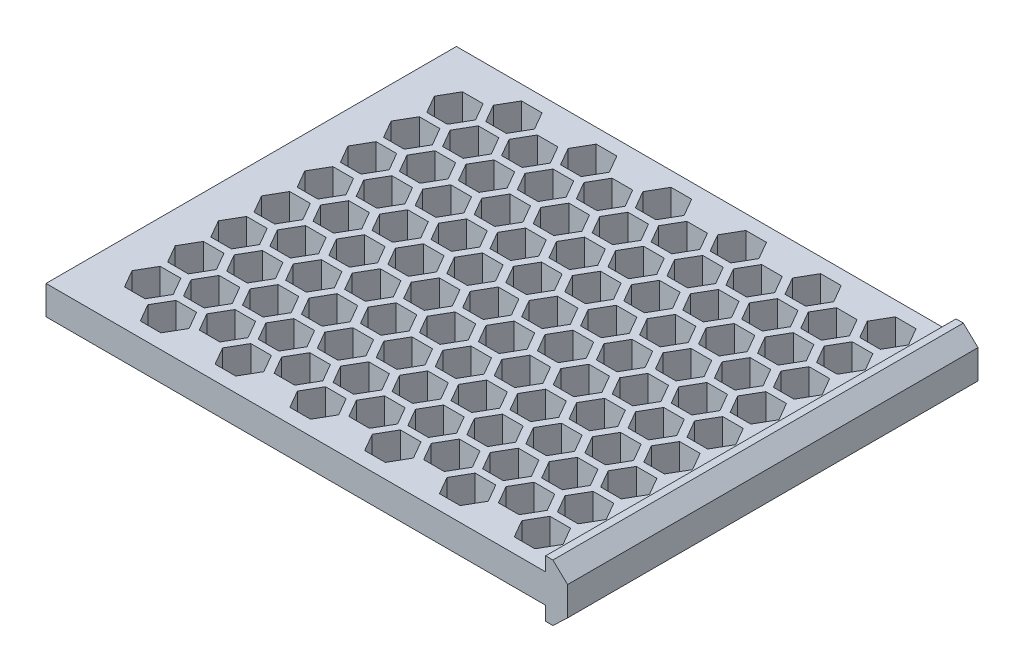
from build123d import *

# Parameters (mm, degrees)
BOSS_EXTRUDE1_DEPTH = 115
CUT_EXTRUDE3_DEPTH  = 182.573676506


with BuildPart() as part:
    # Sketch1 → Boss-Extrude1 (new body)
    with BuildSketch(Plane.XY):
        Polygon((-140, -4.05), (0, -4.05), (0, -7.95), (2.04, -7.95), (6.152414984, -4.048), (6.152414984, 4.048), (2.04, 7.95), (0, 7.95), (0, 4.05), (-140, 4.05), align=None)
    extrude(amount=BOSS_EXTRUDE1_DEPTH)

    # Sketch2 → Cut-Extrude3 (cut, through all)
    with BuildSketch(Plane(origin=(0, 4.05, 0), x_dir=(1, 0, 0), z_dir=(0, 1, 0))):
        Polygon((-7.113248654, -14.1), (-4.226497308, -9.1), (-7.113248654, -4.1), (-12.886751346, -4.1), (-15.773502692, -9.1), (-12.886751346, -14.1), align=None)
        Polygon((-7.113248654, -26.2), (-4.226497308, -21.2), (-7.113248654, -16.2), (-12.886751346, -16.2), (-15.773502692, -21.2), (-12.886751346, -26.2), align=None)
        Polygon((-7.113248654, -38.3), (-4.226497308, -33.3), (-7.113248654, -28.3), (-12.886751346, -28.3), (-15.773502692, -33.3), (-12.886751346, -38.3), align=None)
        Polygon((-7.113248654, -50.4), (-4.226497308, -45.4), (-7.113248654, -40.4), (-12.886751346, -40.4), (-15.773502692, -45.4), (-12.886751346, -50.4), align=None)
        Polygon((-7.113248654, -62.5), (-4.226497308, -57.5), (-7.113248654, -52.5), (-12.886751346, -52.5), (-15.773502692, -57.5), (-12.886751346, -62.5), align=None)
        Polygon((-7.113248654, -74.6), (-4.226497308, -69.6), (-7.113248654, -64.6), (-12.886751346, -64.6), (-15.773502692, -69.6), (-12.886751346, -74.6), align=None)
        Polygon((-7.113248654, -86.7), (-4.226497308, -81.7), (-7.113248654, -76.7), (-12.886751346, -76.7), (-15.773502692, -81.7), (-12.886751346, -86.7), align=None)
        Polygon((-7.113248654, -98.8), (-4.226497308, -93.8), (-7.113248654, -88.8), (-12.886751346, -88.8), (-15.773502692, -93.8), (-12.886751346, -98.8), align=None)
        Polygon((-7.113248654, -110.9), (-4.226497308, -105.9), (-7.113248654, -100.9), (-12.886751346, -100.9), (-15.773502692, -105.9), (-12.886751346, -110.9), align=None)
        Polygon((-17.59215604, -20.15), (-14.705404694, -15.15), (-17.59215604, -10.15), (-23.365658732, -10.15), (-26.252410078, -15.15), (-23.365658732, -20.15), align=None)
        Polygon((-17.59215604, -32.25), (-14.705404694, -27.25), (-17.59215604, -22.25), (-23.365658732, -22.25), (-26.252410078, -27.25), (-23.365658732, -32.25), align=None)
        Polygon((-17.59215604, -44.35), (-14.705404694, -39.35), (-17.59215604, -34.35), (-23.365658732, -34.35), (-26.252410078, -39.35), (-23.365658732, -44.35), align=None)
        Polygon((-17.59215604, -56.45), (-14.705404694, -51.45), (-17.59215604, -46.45), (-23.365658732, -46.45), (-26.252410078, -51.45), (-23.365658732, -56.45), align=None)
        Polygon((-17.59215604, -68.55), (-14.705404694, -63.55), (-17.59215604, -58.55), (-23.365658732, -58.55), (-26.252410078, -63.55), (-23.365658732, -68.55), align=None)
        Polygon((-17.59215604, -80.65), (-14.705404694, -75.65), (-17.59215604, -70.65), (-23.365658732, -70.65), (-26.252410078, -75.65), (-23.365658732, -80.65), align=None)
        Polygon((-17.59215604, -92.75), (-14.705404694, -87.75), (-17.59215604, -82.75), (-23.365658732, -82.75), (-26.252410078, -87.75), (-23.365658732, -92.75), align=None)
        Polygon((-17.59215604, -104.85), (-14.705404694, -99.85), (-17.59215604, -94.85), (-23.365658732, -94.85), (-26.252410078, -99.85), (-23.365658732, -104.85), align=None)
        Polygon((-28.071063426, -14.1), (-25.18431208, -9.1), (-28.071063426, -4.1), (-33.844566118, -4.1), (-36.731317463, -9.1), (-33.844566118, -14.1), align=None)
        Polygon((-28.071063426, -26.2), (-25.18431208, -21.2), (-28.071063426, -16.2), (-33.844566118, -16.2), (-36.731317463, -21.2), (-33.844566118, -26.2), align=None)
        Polygon((-28.071063426, -38.3), (-25.18431208, -33.3), (-28.071063426, -28.3), (-33.844566118, -28.3), (-36.731317463, -33.3), (-33.844566118, -38.3), align=None)
        Polygon((-28.071063426, -50.4), (-25.18431208, -45.4), (-28.071063426, -40.4), (-33.844566118, -40.4), (-36.731317463, -45.4), (-33.844566118, -50.4), align=None)
        Polygon((-28.071063426, -62.5), (-25.18431208, -57.5), (-28.071063426, -52.5), (-33.844566118, -52.5), (-36.731317463, -57.5), (-33.844566118, -62.5), align=None)
        Polygon((-28.071063426, -74.6), (-25.18431208, -69.6), (-28.071063426, -64.6), (-33.844566118, -64.6), (-36.731317463, -69.6), (-33.844566118, -74.6), align=None)
        Polygon((-28.071063426, -86.7), (-25.18431208, -81.7), (-28.071063426, -76.7), (-33.844566118, -76.7), (-36.731317463, -81.7), (-33.844566118, -86.7), align=None)
        Polygon((-28.071063426, -98.8), (-25.18431208, -93.8), (-28.071063426, -88.8), (-33.844566118, -88.8), (-36.731317463, -93.8), (-33.844566118, -98.8), align=None)
        Polygon((-28.071063426, -110.9), (-25.18431208, -105.9), (-28.071063426, -100.9), (-33.844566118, -100.9), (-36.731317463, -105.9), (-33.844566118, -110.9), align=None)
        Polygon((-38.549970811, -20.15), (-35.663219465, -15.15), (-38.549970811, -10.15), (-44.323473503, -10.15), (-47.210224849, -15.15), (-44.323473503, -20.15), align=None)
        Polygon((-38.549970811, -32.25), (-35.663219465, -27.25), (-38.549970811, -22.25), (-44.323473503, -22.25), (-47.210224849, -27.25), (-44.323473503, -32.25), align=None)
        Polygon((-38.549970811, -44.35), (-35.663219465, -39.35), (-38.549970811, -34.35), (-44.323473503, -34.35), (-47.210224849, -39.35), (-44.323473503, -44.35), align=None)
        Polygon((-38.549970811, -56.45), (-35.663219465, -51.45), (-38.549970811, -46.45), (-44.323473503, -46.45), (-47.210224849, -51.45), (-44.323473503, -56.45), align=None)
        Polygon((-38.549970811, -68.55), (-35.663219465, -63.55), (-38.549970811, -58.55), (-44.323473503, -58.55), (-47.210224849, -63.55), (-44.323473503, -68.55), align=None)
        Polygon((-38.549970811, -80.65), (-35.663219465, -75.65), (-38.549970811, -70.65), (-44.323473503, -70.65), (-47.210224849, -75.65), (-44.323473503, -80.65), align=None)
        Polygon((-38.549970811, -92.75), (-35.663219465, -87.75), (-38.549970811, -82.75), (-44.323473503, -82.75), (-47.210224849, -87.75), (-44.323473503, -92.75), align=None)
        Polygon((-38.549970811, -104.85), (-35.663219465, -99.85), (-38.549970811, -94.85), (-44.323473503, -94.85), (-47.210224849, -99.85), (-44.323473503, -104.85), align=None)
        Polygon((-49.028878197, -14.1), (-46.142126851, -9.1), (-49.028878197, -4.1), (-54.802380889, -4.1), (-57.689132235, -9.1), (-54.802380889, -14.1), align=None)
        Polygon((-49.028878197, -26.2), (-46.142126851, -21.2), (-49.028878197, -16.2), (-54.802380889, -16.2), (-57.689132235, -21.2), (-54.802380889, -26.2), align=None)
        Polygon((-49.028878197, -38.3), (-46.142126851, -33.3), (-49.028878197, -28.3), (-54.802380889, -28.3), (-57.689132235, -33.3), (-54.802380889, -38.3), align=None)
        Polygon((-49.028878197, -50.4), (-46.142126851, -45.4), (-49.028878197, -40.4), (-54.802380889, -40.4), (-57.689132235, -45.4), (-54.802380889, -50.4), align=None)
        Polygon((-49.028878197, -62.5), (-46.142126851, -57.5), (-49.028878197, -52.5), (-54.802380889, -52.5), (-57.689132235, -57.5), (-54.802380889, -62.5), align=None)
        Polygon((-49.028878197, -74.6), (-46.142126851, -69.6), (-49.028878197, -64.6), (-54.802380889, -64.6), (-57.689132235, -69.6), (-54.802380889, -74.6), align=None)
        Polygon((-49.028878197, -86.7), (-46.142126851, -81.7), (-49.028878197, -76.7), (-54.802380889, -76.7), (-57.689132235, -81.7), (-54.802380889, -86.7), align=None)
        Polygon((-49.028878197, -98.8), (-46.142126851, -93.8), (-49.028878197, -88.8), (-54.802380889, -88.8), (-57.689132235, -93.8), (-54.802380889, -98.8), align=None)
        Polygon((-49.028878197, -110.9), (-46.142126851, -105.9), (-49.028878197, -100.9), (-54.802380889, -100.9), (-57.689132235, -105.9), (-54.802380889, -110.9), align=None)
        Polygon((-59.507785583, -20.15), (-56.621034237, -15.15), (-59.507785583, -10.15), (-65.281288275, -10.15), (-68.168039621, -15.15), (-65.281288275, -20.15), align=None)
        Polygon((-59.507785583, -32.25), (-56.621034237, -27.25), (-59.507785583, -22.25), (-65.281288275, -22.25), (-68.168039621, -27.25), (-65.281288275, -32.25), align=None)
        Polygon((-59.507785583, -44.35), (-56.621034237, -39.35), (-59.507785583, -34.35), (-65.281288275, -34.35), (-68.168039621, -39.35), (-65.281288275, -44.35), align=None)
        Polygon((-59.507785583, -56.45), (-56.621034237, -51.45), (-59.507785583, -46.45), (-65.281288275, -46.45), (-68.168039621, -51.45), (-65.281288275, -56.45), align=None)
        Polygon((-59.507785583, -68.55), (-56.621034237, -63.55), (-59.507785583, -58.55), (-65.281288275, -58.55), (-68.168039621, -63.55), (-65.281288275, -68.55), align=None)
        Polygon((-59.507785583, -80.65), (-56.621034237, -75.65), (-59.507785583, -70.65), (-65.281288275, -70.65), (-68.168039621, -75.65), (-65.281288275, -80.65), align=None)
        Polygon((-59.507785583, -92.75), (-56.621034237, -87.75), (-59.507785583, -82.75), (-65.281288275, -82.75), (-68.168039621, -87.75), (-65.281288275, -92.75), align=None)
        Polygon((-59.507785583, -104.85), (-56.621034237, -99.85), (-59.507785583, -94.85), (-65.281288275, -94.85), (-68.168039621, -99.85), (-65.281288275, -104.85), align=None)
        Polygon((-69.986692969, -14.1), (-67.099941623, -9.1), (-69.986692969, -4.1), (-75.760195661, -4.1), (-78.646947007, -9.1), (-75.760195661, -14.1), align=None)
        Polygon((-69.986692969, -26.2), (-67.099941623, -21.2), (-69.986692969, -16.2), (-75.760195661, -16.2), (-78.646947007, -21.2), (-75.760195661, -26.2), align=None)
        Polygon((-69.986692969, -38.3), (-67.099941623, -33.3), (-69.986692969, -28.3), (-75.760195661, -28.3), (-78.646947007, -33.3), (-75.760195661, -38.3), align=None)
        Polygon((-69.986692969, -50.4), (-67.099941623, -45.4), (-69.986692969, -40.4), (-75.760195661, -40.4), (-78.646947007, -45.4), (-75.760195661, -50.4), align=None)
        Polygon((-69.986692969, -62.5), (-67.099941623, -57.5), (-69.986692969, -52.5), (-75.760195661, -52.5), (-78.646947007, -57.5), (-75.760195661, -62.5), align=None)
        Polygon((-69.986692969, -74.6), (-67.099941623, -69.6), (-69.986692969, -64.6), (-75.760195661, -64.6), (-78.646947007, -69.6), (-75.760195661, -74.6), align=None)
        Polygon((-69.986692969, -86.7), (-67.099941623, -81.7), (-69.986692969, -76.7), (-75.760195661, -76.7), (-78.646947007, -81.7), (-75.760195661, -86.7), align=None)
        Polygon((-69.986692969, -98.8), (-67.099941623, -93.8), (-69.986692969, -88.8), (-75.760195661, -88.8), (-78.646947007, -93.8), (-75.760195661, -98.8), align=None)
        Polygon((-69.986692969, -110.9), (-67.099941623, -105.9), (-69.986692969, -100.9), (-75.760195661, -100.9), (-78.646947007, -105.9), (-75.760195661, -110.9), align=None)
        Polygon((-80.465600355, -20.15), (-77.578849009, -15.15), (-80.465600355, -10.15), (-86.239103046, -10.15), (-89.125854392, -15.15), (-86.239103046, -20.15), align=None)
        Polygon((-80.465600355, -32.25), (-77.578849009, -27.25), (-80.465600355, -22.25), (-86.239103046, -22.25), (-89.125854392, -27.25), (-86.239103046, -32.25), align=None)
        Polygon((-80.465600355, -44.35), (-77.578849009, -39.35), (-80.465600355, -34.35), (-86.239103046, -34.35), (-89.125854392, -39.35), (-86.239103046, -44.35), align=None)
        Polygon((-80.465600355, -56.45), (-77.578849009, -51.45), (-80.465600355, -46.45), (-86.239103046, -46.45), (-89.125854392, -51.45), (-86.239103046, -56.45), align=None)
        Polygon((-80.465600355, -68.55), (-77.578849009, -63.55), (-80.465600355, -58.55), (-86.239103046, -58.55), (-89.125854392, -63.55), (-86.239103046, -68.55), align=None)
        Polygon((-80.465600355, -80.65), (-77.578849009, -75.65), (-80.465600355, -70.65), (-86.239103046, -70.65), (-89.125854392, -75.65), (-86.239103046, -80.65), align=None)
        Polygon((-80.465600355, -92.75), (-77.578849009, -87.75), (-80.465600355, -82.75), (-86.239103046, -82.75), (-89.125854392, -87.75), (-86.239103046, -92.75), align=None)
        Polygon((-80.465600355, -104.85), (-77.578849009, -99.85), (-80.465600355, -94.85), (-86.239103046, -94.85), (-89.125854392, -99.85), (-86.239103046, -104.85), align=None)
        Polygon((-90.94450774, -14.1), (-88.057756394, -9.1), (-90.94450774, -4.1), (-96.718010432, -4.1), (-99.604761778, -9.1), (-96.718010432, -14.1), align=None)
        Polygon((-90.94450774, -26.2), (-88.057756394, -21.2), (-90.94450774, -16.2), (-96.718010432, -16.2), (-99.604761778, -21.2), (-96.718010432, -26.2), align=None)
        Polygon((-90.94450774, -38.3), (-88.057756394, -33.3), (-90.94450774, -28.3), (-96.718010432, -28.3), (-99.604761778, -33.3), (-96.718010432, -38.3), align=None)
        Polygon((-90.94450774, -50.4), (-88.057756394, -45.4), (-90.94450774, -40.4), (-96.718010432, -40.4), (-99.604761778, -45.4), (-96.718010432, -50.4), align=None)
        Polygon((-90.94450774, -62.5), (-88.057756394, -57.5), (-90.94450774, -52.5), (-96.718010432, -52.5), (-99.604761778, -57.5), (-96.718010432, -62.5), align=None)
        Polygon((-90.94450774, -74.6), (-88.057756394, -69.6), (-90.94450774, -64.6), (-96.718010432, -64.6), (-99.604761778, -69.6), (-96.718010432, -74.6), align=None)
        Polygon((-90.94450774, -86.7), (-88.057756394, -81.7), (-90.94450774, -76.7), (-96.718010432, -76.7), (-99.604761778, -81.7), (-96.718010432, -86.7), align=None)
        Polygon((-90.94450774, -98.8), (-88.057756394, -93.8), (-90.94450774, -88.8), (-96.718010432, -88.8), (-99.604761778, -93.8), (-96.718010432, -98.8), align=None)
        Polygon((-90.94450774, -110.9), (-88.057756394, -105.9), (-90.94450774, -100.9), (-96.718010432, -100.9), (-99.604761778, -105.9), (-96.718010432, -110.9), align=None)
        Polygon((-101.423415126, -20.15), (-98.53666378, -15.15), (-101.423415126, -10.15), (-107.196917818, -10.15), (-110.083669164, -15.15), (-107.196917818, -20.15), align=None)
        Polygon((-101.423415126, -32.25), (-98.53666378, -27.25), (-101.423415126, -22.25), (-107.196917818, -22.25), (-110.083669164, -27.25), (-107.196917818, -32.25), align=None)
        Polygon((-101.423415126, -44.35), (-98.53666378, -39.35), (-101.423415126, -34.35), (-107.196917818, -34.35), (-110.083669164, -39.35), (-107.196917818, -44.35), align=None)
        Polygon((-101.423415126, -56.45), (-98.53666378, -51.45), (-101.423415126, -46.45), (-107.196917818, -46.45), (-110.083669164, -51.45), (-107.196917818, -56.45), align=None)
        Polygon((-101.423415126, -68.55), (-98.53666378, -63.55), (-101.423415126, -58.55), (-107.196917818, -58.55), (-110.083669164, -63.55), (-107.196917818, -68.55), align=None)
        Polygon((-101.423415126, -80.65), (-98.53666378, -75.65), (-101.423415126, -70.65), (-107.196917818, -70.65), (-110.083669164, -75.65), (-107.196917818, -80.65), align=None)
        Polygon((-101.423415126, -92.75), (-98.53666378, -87.75), (-101.423415126, -82.75), (-107.196917818, -82.75), (-110.083669164, -87.75), (-107.196917818, -92.75), align=None)
        Polygon((-101.423415126, -104.85), (-98.53666378, -99.85), (-101.423415126, -94.85), (-107.196917818, -94.85), (-110.083669164, -99.85), (-107.196917818, -104.85), align=None)
        Polygon((-111.902322512, -14.1), (-109.015571166, -9.1), (-111.902322512, -4.1), (-117.675825204, -4.1), (-120.56257655, -9.1), (-117.675825204, -14.1), align=None)
        Polygon((-111.902322512, -26.2), (-109.015571166, -21.2), (-111.902322512, -16.2), (-117.675825204, -16.2), (-120.56257655, -21.2), (-117.675825204, -26.2), align=None)
        Polygon((-111.902322512, -38.3), (-109.015571166, -33.3), (-111.902322512, -28.3), (-117.675825204, -28.3), (-120.56257655, -33.3), (-117.675825204, -38.3), align=None)
        Polygon((-111.902322512, -50.4), (-109.015571166, -45.4), (-111.902322512, -40.4), (-117.675825204, -40.4), (-120.56257655, -45.4), (-117.675825204, -50.4), align=None)
        Polygon((-111.902322512, -62.5), (-109.015571166, -57.5), (-111.902322512, -52.5), (-117.675825204, -52.5), (-120.56257655, -57.5), (-117.675825204, -62.5), align=None)
        Polygon((-111.902322512, -74.6), (-109.015571166, -69.6), (-111.902322512, -64.6), (-117.675825204, -64.6), (-120.56257655, -69.6), (-117.675825204, -74.6), align=None)
        Polygon((-111.902322512, -86.7), (-109.015571166, -81.7), (-111.902322512, -76.7), (-117.675825204, -76.7), (-120.56257655, -81.7), (-117.675825204, -86.7), align=None)
        Polygon((-111.902322512, -98.8), (-109.015571166, -93.8), (-111.902322512, -88.8), (-117.675825204, -88.8), (-120.56257655, -93.8), (-117.675825204, -98.8), align=None)
        Polygon((-111.902322512, -110.9), (-109.015571166, -105.9), (-111.902322512, -100.9), (-117.675825204, -100.9), (-120.56257655, -105.9), (-117.675825204, -110.9), align=None)
        Polygon((-122.381229898, -20.15), (-119.494478552, -15.15), (-122.381229898, -10.15), (-128.15473259, -10.15), (-131.041483936, -15.15), (-128.15473259, -20.15), align=None)
        Polygon((-122.381229898, -32.25), (-119.494478552, -27.25), (-122.381229898, -22.25), (-128.15473259, -22.25), (-131.041483936, -27.25), (-128.15473259, -32.25), align=None)
        Polygon((-122.381229898, -44.35), (-119.494478552, -39.35), (-122.381229898, -34.35), (-128.15473259, -34.35), (-131.041483936, -39.35), (-128.15473259, -44.35), align=None)
        Polygon((-122.381229898, -56.45), (-119.494478552, -51.45), (-122.381229898, -46.45), (-128.15473259, -46.45), (-131.041483936, -51.45), (-128.15473259, -56.45), align=None)
        Polygon((-122.381229898, -68.55), (-119.494478552, -63.55), (-122.381229898, -58.55), (-128.15473259, -58.55), (-131.041483936, -63.55), (-128.15473259, -68.55), align=None)
        Polygon((-122.381229898, -80.65), (-119.494478552, -75.65), (-122.381229898, -70.65), (-128.15473259, -70.65), (-131.041483936, -75.65), (-128.15473259, -80.65), align=None)
        Polygon((-122.381229898, -92.75), (-119.494478552, -87.75), (-122.381229898, -82.75), (-128.15473259, -82.75), (-131.041483936, -87.75), (-128.15473259, -92.75), align=None)
        Polygon((-122.381229898, -104.85), (-119.494478552, -99.85), (-122.381229898, -94.85), (-128.15473259, -94.85), (-131.041483936, -99.85), (-128.15473259, -104.85), align=None)
    extrude(amount=-CUT_EXTRUDE3_DEPTH, mode=Mode.SUBTRACT)


solid = part.part
